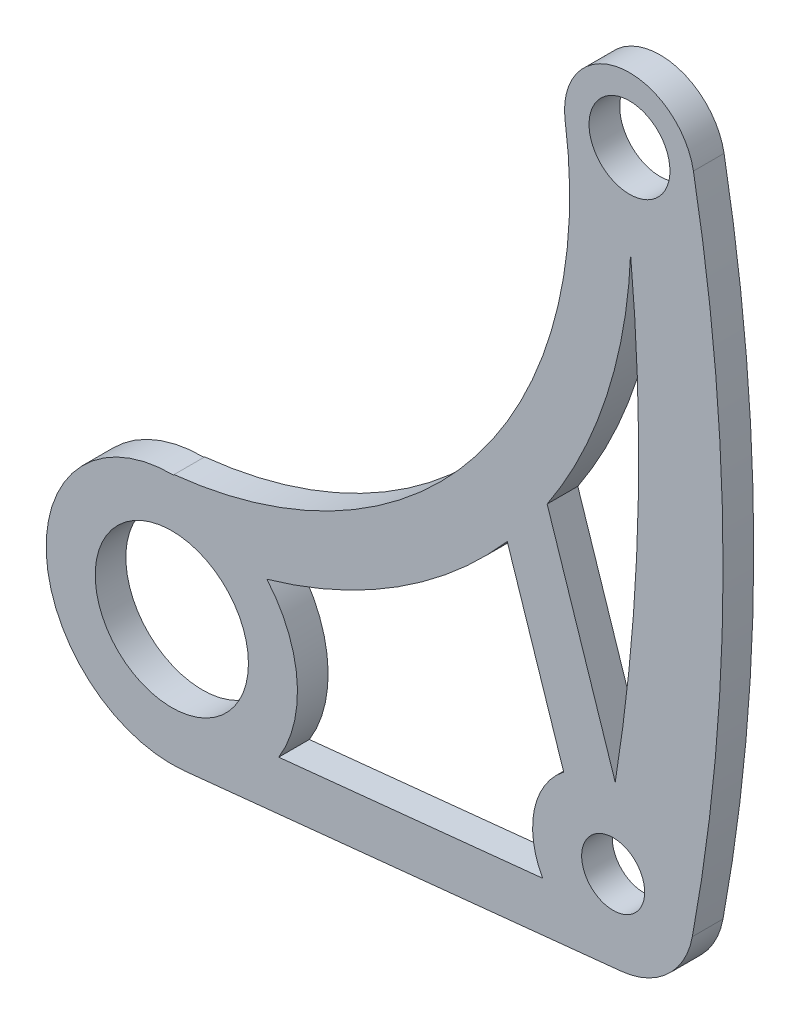
from build123d import *

# Parameters (mm, degrees)
SKETCH2_R           = 7.9375
SKETCH2_R_2         = 4.191
SKETCH2_R_3         = 3.2639
BOSS_EXTRUDE1_DEPTH = 3.175


with BuildPart() as part:
    # Sketch2 → Boss-Extrude1 (new body)
    with BuildSketch(Plane.XY):
        with BuildLine():
            Line((1.330677778, -12.949308974), (46.572932, -8.300191215))
            ThreePointArc((46.572932, -8.300191215), (51.37742802, -6.133039654), (53.924522362, -1.518709983))
            ThreePointArc((53.924522362, -1.518709983), (57.106411985, 32.846575472), (54.035830718, 67.22198524))
            ThreePointArc((54.035830718, 67.22198524), (46.333024889, 72.662028043), (40.750647472, 65.061742146))
            ThreePointArc((40.750647472, 65.061742146), (31.550758366, 30.452598432), (0.230104832, 13.090356345))
            Line((0.230104832, 13.090356345), (0.171615761, 13.016368706))
            ThreePointArc((0.171615761, 13.016368706), (-13.004550196, -0.580500165), (1.330677778, -12.949308974))
        make_face()
        Circle(SKETCH2_R, mode=Mode.SUBTRACT)
        with BuildLine():
            ThreePointArc((38.882442516, 29.775817606), (45.039190515, 42.544935267), (47.523781163, 56.501393309))
            ThreePointArc((47.523781163, 56.501393309), (48.257752726, 32.370804269), (45.933946154, 8.34115665))
            Line((45.933946154, 8.34115665), (38.882442516, 29.775817606))
        make_face(mode=Mode.SUBTRACT)
        with BuildLine():
            ThreePointArc((9.848859751, 8.512066016), (23.445327069, 14.632175726), (34.749899024, 24.354640398))
            Line((34.749899024, 24.354640398), (40.595697266, 6.584997244))
            ThreePointArc((40.595697266, 6.584997244), (37.546758205, 1.678923993), (38.414831114, -4.031770672))
            Line((38.414831114, -4.031770672), (11.074870198, -6.841239387))
            ThreePointArc((11.074870198, -6.841239387), (12.976194182, 1.036190528), (9.848859751, 8.512066016))
        make_face(mode=Mode.SUBTRACT)
        with Locations((47.413333333, 66.018287029)):
            Circle(SKETCH2_R_2, mode=Mode.SUBTRACT)
        with Locations((45.72, 0)):
            Circle(SKETCH2_R_3, mode=Mode.SUBTRACT)
    extrude(amount=BOSS_EXTRUDE1_DEPTH)


solid = part.part
